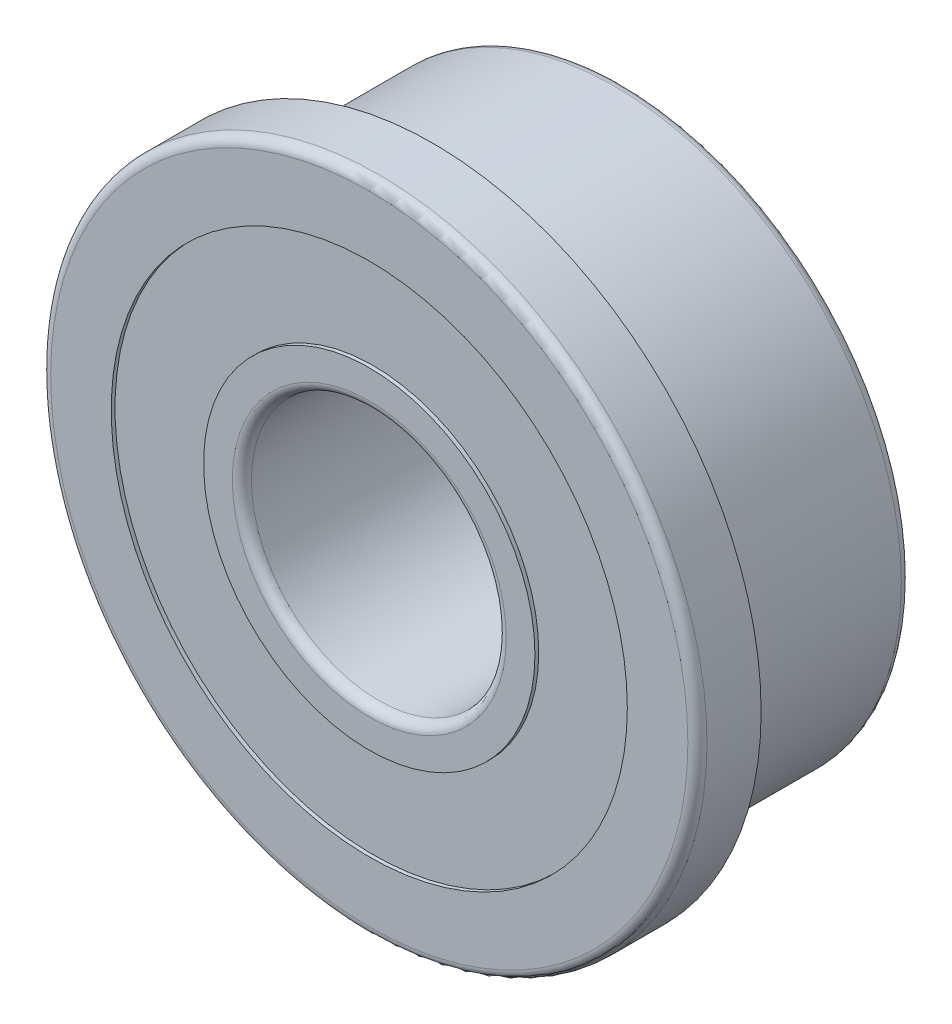
from build123d import *

# Parameters (mm, degrees)
SKETCH1_R           = 4.5
BOSS_EXTRUDE1_DEPTH = 3
SKETCH2_R           = 5.15
BOSS_EXTRUDE2_DEPTH = 1
SKETCH3_R           = 2
CUT_EXTRUDE1_DEPTH  = 9.309332103
SKETCH4_R           = 4.05
SKETCH4_R_2         = 2.6
CUT_EXTRUDE2_DEPTH  = 0.06
CUT_EXTRUDE3_START  = -0.06
SKETCH5_R           = 4.05
SKETCH5_R_2         = 2.6
CUT_EXTRUDE3_DEPTH  = 0.06
FILLET1_R           = 0.15


with BuildPart() as part:
    # Sketch1 → Boss-Extrude1 (new body)
    with BuildSketch(Plane.XY):
        Circle(SKETCH1_R)
    extrude(amount=BOSS_EXTRUDE1_DEPTH)

    # Sketch2 → Boss-Extrude2 (add)
    with BuildSketch(Plane.XY.offset(3)):
        Circle(SKETCH2_R)
    extrude(amount=BOSS_EXTRUDE2_DEPTH)

    # Sketch3 → Cut-Extrude1 (cut, through all)
    with BuildSketch(Plane.XY.offset(4)):
        Circle(SKETCH3_R)
    extrude(amount=-CUT_EXTRUDE1_DEPTH, mode=Mode.SUBTRACT)

    # Sketch4 → Cut-Extrude2 (cut)
    with BuildSketch(Plane.XY.offset(4)):
        Circle(SKETCH4_R)
        Circle(SKETCH4_R_2, mode=Mode.SUBTRACT)
    extrude(amount=-CUT_EXTRUDE2_DEPTH, mode=Mode.SUBTRACT)

    # Sketch5 → Cut-Extrude3 (cut)
    with BuildSketch(Plane(origin=(0, 0, 0), x_dir=(-1, 0, 0), z_dir=(0, 0, -1)).offset(CUT_EXTRUDE3_START)):
        Circle(SKETCH5_R)
        Circle(SKETCH5_R_2, mode=Mode.SUBTRACT)
    extrude(amount=CUT_EXTRUDE3_DEPTH, mode=Mode.SUBTRACT)

    # Fillet1
    fillet1_edges = [part.edges().sort_by_distance(p)[0] for p in [
        (-5.15, 0, 4),
        (-2, 0, 0),
        (-4.5, 0, 0),
        (-2, 0, 4),
    ]]
    fillet(fillet1_edges, radius=FILLET1_R)


solid = part.part
